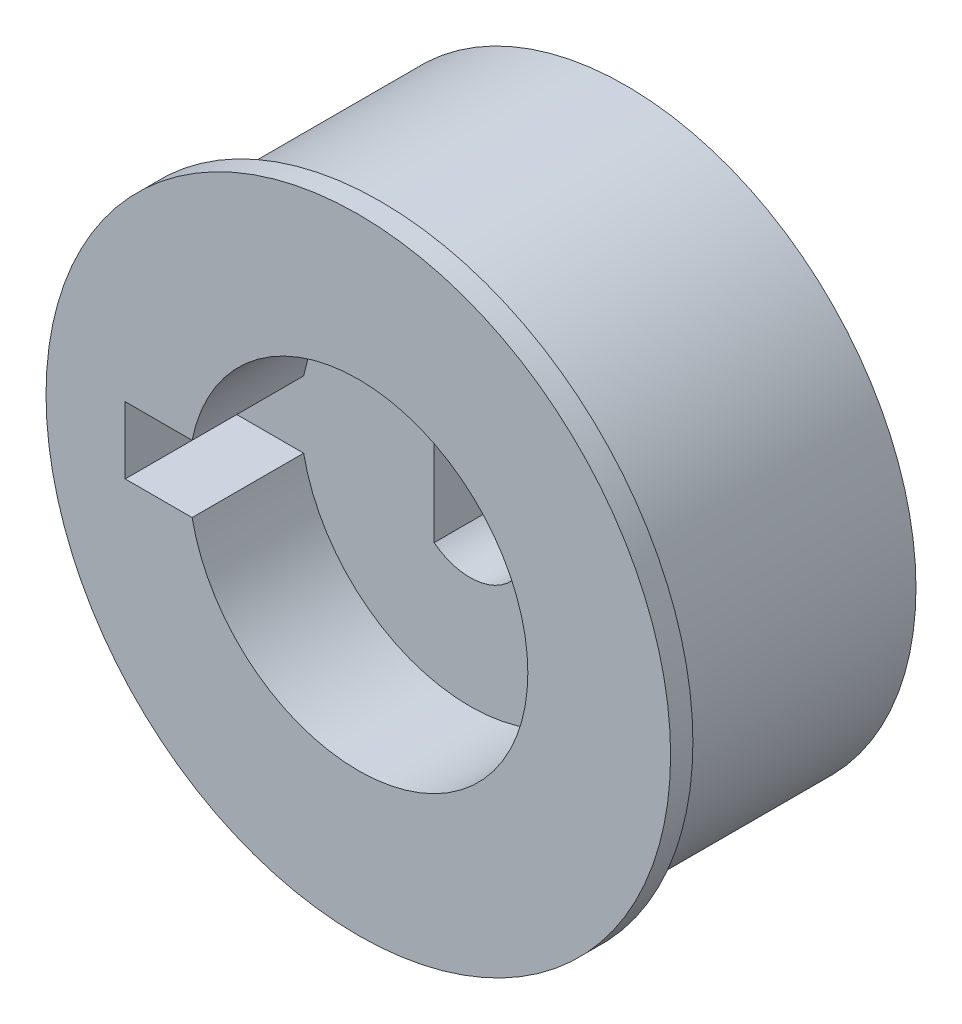
from build123d import *

# Parameters (mm, degrees)
SKETCH_1_R          = 13
SKETCH_1_R_2        = 2.6
SKETCH_1_R_3        = 1.4
EXTRUDE_1_DEPTH     = 4
SKETCH_1_3_R        = 13
SKETCH_1_3_R_2      = 2.6
EXTRUDE_2_DEPTH     = 12
EXTRUDE_START       = 11
SKETCH_1_6_R        = 14
SKETCH_1_6_R_2      = 13
EXTRUDE_3_DEPTH     = 1
CUT_EXTRUDE_1_DEPTH = 5
SKETCH_6_R          = 7.6
SKETCH_6_W          = 3
SKETCH_6_H          = 3
CUT_EXTRUDE_5_DEPTH = 5
SKETCH_5_R          = 5
CUT_EXTRUDE_6_DEPTH = 2
FILLET_1_R          = 12


with BuildPart() as part:
    # 草图1 → 凸台-拉伸1 (new body)
    # profile 1 of 3: a face of its own
    with BuildSketch(Plane.XY):
        Circle(SKETCH_1_R)
        Circle(SKETCH_1_R_2, mode=Mode.SUBTRACT)
    # profile 2 of 3: a face of its own
    with BuildSketch(Plane.XY):
        with BuildLine():
            Line((-1.6, -2.049390153), (-1.6, 2.049390153))
            ThreePointArc((-1.6, 2.049390153), (-2.6, 0), (-1.6, -2.049390153))
        make_face()
    # profile 3 of 3: a face of its own
    with BuildSketch(Plane.XY):
        with BuildLine():
            ThreePointArc((2.6, 0), (1.140175425, 2.336664289), (-1.6, 2.049390153))
            Line((-1.6, 2.049390153), (-1.6, -2.049390153))
            ThreePointArc((-1.6, -2.049390153), (1.140175425, -2.336664289), (2.6, 0))
        make_face()
        Circle(SKETCH_1_R_3, mode=Mode.SUBTRACT)
    extrude(amount=EXTRUDE_1_DEPTH)

    # 草图1<3> → 凸台-拉伸2 (add)
    # profile 1 of 2: a face of its own
    with BuildSketch(Plane.XY):
        Circle(SKETCH_1_3_R)
        Circle(SKETCH_1_3_R_2, mode=Mode.SUBTRACT)
    # profile 2 of 2: a face of its own
    with BuildSketch(Plane.XY):
        with BuildLine():
            Line((-1.6, -2.049390153), (-1.6, 2.049390153))
            ThreePointArc((-1.6, 2.049390153), (-2.6, 0), (-1.6, -2.049390153))
        make_face()
    extrude(amount=EXTRUDE_2_DEPTH)

    # 草图1<6> → 凸台-拉伸3 (add)
    with BuildSketch(Plane.XY.offset(EXTRUDE_START)):
        Circle(SKETCH_1_6_R)
        Circle(SKETCH_1_6_R_2, mode=Mode.SUBTRACT)
    extrude(amount=EXTRUDE_3_DEPTH)

    # 草图3 → 切除-拉伸1 (cut)
    with BuildSketch(Plane(origin=(0, 0, 0), x_dir=(-1, 0, 0), z_dir=(0, 0, -1))):
        with BuildLine():
            Line((-10.746987514, -5.338750731), (-4.305410284, -1.619704383))
            ThreePointArc((-4.305410284, -1.619704383), (-3.983716857, 2.3), (-0.75, 4.538446871))
            Line((-0.75, 4.538446871), (-0.75, 11.976539567))
            ThreePointArc((-0.75, 11.976539567), (-10.392304845, 6), (-10.746987514, -5.338750731))
        make_face()
        with BuildLine():
            Line((9.996987514, -6.637788836), (3.555410284, -2.918742488))
            ThreePointArc((3.555410284, -2.918742488), (0, -4.6), (-3.555410284, -2.918742488))
            Line((-3.555410284, -2.918742488), (-9.996987514, -6.637788836))
            ThreePointArc((-9.996987514, -6.637788836), (0, -12), (9.996987514, -6.637788836))
        make_face()
        with BuildLine():
            ThreePointArc((4.6, 0), (4.52575338, -0.823138109), (4.305410284, -1.619704383))
            Line((4.305410284, -1.619704383), (10.746987514, -5.338750731))
            ThreePointArc((10.746987514, -5.338750731), (11.682547885, -2.741910814), (12, 0))
            ThreePointArc((12, 0), (8.746427842, 8.215838363), (0.75, 11.976539567))
            Line((0.75, 11.976539567), (0.75, 4.538446871))
            ThreePointArc((0.75, 4.538446871), (3.507848343, 2.975735203), (4.6, 0))
        make_face()
    extrude(amount=-CUT_EXTRUDE_1_DEPTH, mode=Mode.SUBTRACT)

    # 草图6 → 切除-拉伸5 (cut)
    with BuildSketch(Plane.XY.offset(12)):
        Circle(SKETCH_6_R)
        with Locations((-8.950503339, 0)):
            Rectangle(SKETCH_6_W, SKETCH_6_H)
    extrude(amount=-CUT_EXTRUDE_5_DEPTH, mode=Mode.SUBTRACT)

    # 草图5 → 切除-拉伸6 (cut)
    with BuildSketch(Plane(origin=(0, 0, 0), x_dir=(-1, 0, 0), z_dir=(0, 0, -1))):
        Circle(SKETCH_5_R)
    extrude(amount=-CUT_EXTRUDE_6_DEPTH, mode=Mode.SUBTRACT)

    # 圆角1
    # the kernel refuses this fillet: 12 mm, written as the material it takes off along each edge
    with BuildSketch(Plane(origin=(0, 0, 0), x_dir=(-0.0031415874858860904, -0.9999950652018581, 0), z_dir=(0.9999950652018581, -0.0031415874858860904, 0))) as fillet_1_piece_1:
        with BuildLine():
            CenterArc((11.633249581, -12), FILLET_1_R, 90, 33.557309762)
            Line((5, -2), (5, 0))
            Line((5, 0), (11.633249581, 0))
        make_face()
    revolve(axis=Axis((0, 0, 0), (0, 0, -1)), revolution_arc=359.64, mode=Mode.SUBTRACT)
    with BuildSketch(Plane(origin=(0, 0, 0), x_dir=(0.8675919238668026, 0.49727683802998507, 0), z_dir=(-0.49727683802998507, 0.8675919238668026, 0))) as fillet_1_piece_2:
        with BuildLine():
            CenterArc((11.633249581, -12), FILLET_1_R, 90, 33.557309762)
            Line((5, -2), (5, 0))
            Line((5, 0), (11.633249581, 0))
        make_face()
    revolve(axis=Axis((0, 0, 0), (0, 0, -1)), revolution_arc=359.64, mode=Mode.SUBTRACT)
    with BuildSketch(Plane(origin=(0, 0, 0), x_dir=(-0.8644503363809427, 0.5027182271719167, 0), z_dir=(-0.5027182271719167, -0.8644503363809427, 0))) as fillet_1_piece_3:
        with BuildLine():
            CenterArc((11.633249581, -12), FILLET_1_R, 90, 33.557309762)
            Line((5, -2), (5, 0))
            Line((5, 0), (11.633249581, 0))
        make_face()
    revolve(axis=Axis((0, 0, 0), (0, 0, -1)), revolution_arc=359.64, mode=Mode.SUBTRACT)


solid = part.part
